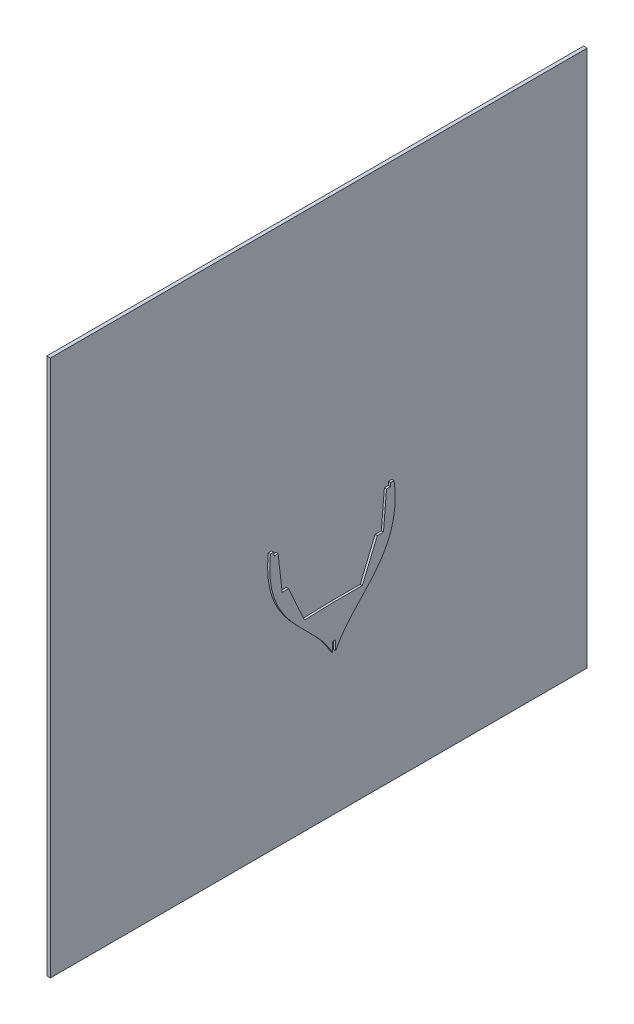
from build123d import *

# Parameters (mm, degrees)
BOSS_EXTRU_2_DEPTH      = 10
BOSS_EXTRU_3_DEPTH      = 6
ENL_V_MAT_EXTRU_1_DEPTH = 6


with BuildPart() as part:
    # Esquisse3D1 → Boss.-Extru.2 (new body)
    with BuildSketch(Plane(origin=(-20, 1121.289346724, 777.274991403), x_dir=(0, -0.7071067811865476, -0.7071067811865476), z_dir=(1, 0, 0))):
        Polygon((0, 0), (1060.66017178, 1060.66017178), (2121.32034356, 0), (1060.66017178, -1060.66017178), align=None)
    extrude(amount=BOSS_EXTRU_2_DEPTH)


with BuildPart() as body_2:
    # Esquisse2 → Boss.-Extru.3 (new body)
    with BuildSketch(Plane(origin=(0, 0, 0), x_dir=(0, 0, -1), z_dir=(1, 0, 0))):
        with BuildLine():
            Line((167.067104912, 360.877811952), (157.067104912, 360.877811952))
            Line((157.067104912, 360.877811952), (157.067104912, 350.877811952))
            Line((157.067104912, 350.877811952), (145.964002973, 350.877811952))
            Line((145.964002973, 350.877811952), (137.482856565, 250.877811952))
            Line((137.482856565, 250.877811952), (120.151818253, 250.877811952))
            Line((120.151818253, 250.877811952), (78.394472682, 150.877811952))
            Line((78.394472682, 150.877811952), (-2.417738449, 150.877811952))
            Line((-2.417738449, 150.877811952), (-83.188457676, 148.28852955))
            Line((-83.188457676, 148.28852955), (-128.128436723, 246.899250023))
            Line((-128.128436723, 246.899250023), (-145.450576656, 246.343950869))
            Line((-145.450576656, 246.343950869), (-157.131441741, 346.020865123))
            Line((-157.131441741, 346.020865123), (-168.228842947, 345.665113609))
            Line((-168.228842947, 345.665113609), (-168.549250267, 355.659979249))
            Line((-168.549250267, 355.659979249), (-178.544115906, 355.339571928))
            add(Edge.make_bspline(
                [(-178.544115906, 355.339571928), (-198.248711361, 164.580604671), (-49.35969787, 130.489458603), (-0.333585219, 20.817226121)],
                knots=[0, 0, 0, 0, 1, 1, 1, 1], degree=3))
            add(Edge.make_bspline(
                [(167.067104912, 360.877811952), (192.87364027, 170.848136891), (45.153377044, 132.003981462), (-0.333585219, 20.817226121)],
                knots=[0, 0, 0, 0, 1, 1, 1, 1], degree=3))
        make_face()
    extrude(amount=BOSS_EXTRU_3_DEPTH)

    # Esquisse3 → Enlèv. mat.-Extru.1 (cut)
    with BuildSketch(Plane(origin=(6, 0, 0), x_dir=(0, 0, -1), z_dir=(1, 0, 0))):
        Polygon((-5.025120531, 30.522238158), (-5.025120531, 57.522238158), (3.974879469, 57.522238158), (3.974879469, 30.522238158), (17.930383855, 10.64180806), (-13.456167531, 12.921278273), align=None)
    extrude(amount=-ENL_V_MAT_EXTRU_1_DEPTH, mode=Mode.SUBTRACT)


solid = Compound([part.part, body_2.part])
